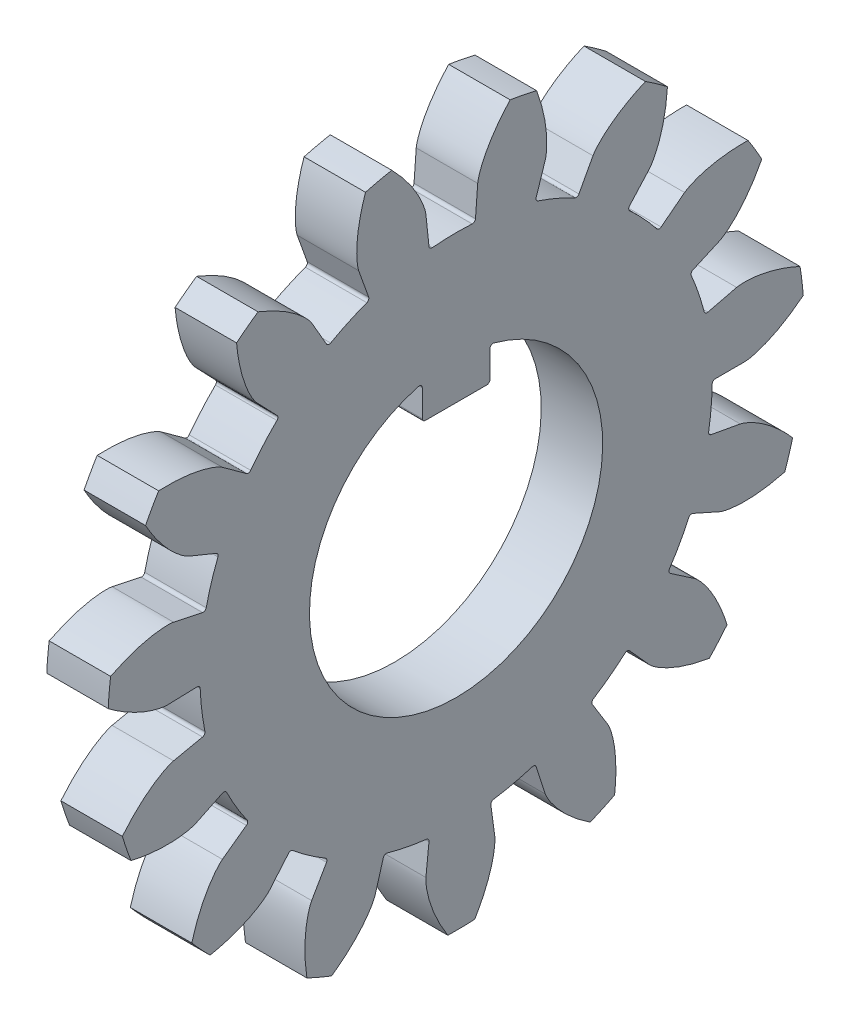
from build123d import *

# Parameters (mm, degrees)
SKETCH1_R                 = 11.333333333
BOSS_EXTRUDE1_DEPTH       = 1
CUT_EXTRUDE1_START        = -1
CUT_EXTRUDE1_DEPTH        = 2
FILLET1_R                 = 0.1
CIRPATTERN12_COUNT        = 15
FILLET1_OF_CIRPATTERN12_R = 0.1
CUT_EXTRUDE2_DEPTH        = 17.141635494
FILLET2_R                 = 0.1


# Read off the part's stored shape, not the designer's step: Cut-Extrude1
with BuildPart() as part:
    # Sketch1 → Boss-Extrude1 (new, symmetric)
    with BuildSketch(Plane(origin=(0, 0, 0), x_dir=(0, 0, -1), z_dir=(1, 0, 0))):
        Circle(SKETCH1_R)
    extrude(amount=BOSS_EXTRUDE1_DEPTH, both=True)

    # Cut-Extrude1 outline → Cut-Extrude1 (cut)
    with BuildSketch(Plane(origin=(0, 0, 0), x_dir=(0, 0, -1), z_dir=(1, 0, 0)).offset(CUT_EXTRUDE1_START)):
        with BuildLine():
            ThreePointArc((10.950535983, -2.920651662), (11.287652182, -1.01653955), (11.29616088, 0.917166185))
            add(Edge.make_bspline(
                [(11.29616088, 0.917166185), (11.279640182, 0.90399033), (11.237319146, 0.870555945), (11.155435851, 0.80693021), (11.07042047, 0.744723989), (10.955773539, 0.66282783), (10.852030268, 0.593612015), (10.738911244, 0.520825098), (10.628720419, 0.454581557), (10.513953634, 0.388998713), (10.399183597, 0.327986428), (10.281576815, 0.269499377), (10.16508062, 0.216257712), (10.06152026, 0.172827787), (9.972266099, 0.138572183), (9.897435615, 0.111957553), (9.835388227, 0.091379097), (9.772845578, 0.072160933), (9.709884453, 0.054493183), (9.646517918, 0.038506069), (9.588036436, 0.025602449), (9.534633285, 0.015508917), (9.489159988, 0.008411766), (9.453894805, 0.003965251), (9.426163522, 0.001399731), (9.409146235, 0.000318961), (9.400138583, 4.6216e-05), (9.396926208, 0)],
                knots=[0.016769687, 0.016769687, 0.016769687, 0.016769687, 0.016769687, 0.054732507, 0.109464833, 0.164197227, 0.218929528, 0.273661933, 0.328394299, 0.383126633, 0.437858978, 0.492591254, 0.547323563, 0.602055883, 0.65278357, 0.680149902, 0.707515959, 0.734882061, 0.762248419, 0.789614739, 0.816980389, 0.844236066, 0.862480775, 0.880559095, 0.894007227, 0.903714166, 0.909090915, 0.909090915, 0.909090915, 0.909090915, 0.909090915], degree=4))
            Line((9.396926208, 0), (8.333333333, 0))
            ThreePointArc((8.333333333, 0), (8.299744252, -0.747455552), (8.199247781, -1.48888558))
            Line((8.199247781, -1.48888558), (9.245727163, -1.678913751))
            add(Edge.make_bspline(
                [(9.245727163, -1.678913751), (9.248879593, -1.679533166), (9.257693579, -1.681410886), (9.274243956, -1.685514682), (9.301070663, -1.692993566), (9.334973978, -1.703669235), (9.378447576, -1.718776735), (9.429188083, -1.738249201), (9.48442314, -1.761393867), (9.543913733, -1.788445207), (9.602705165, -1.817077706), (9.660807849, -1.847160908), (9.718180202, -1.878494026), (9.787051507, -1.918050103), (9.868749224, -1.967701233), (9.962883807, -2.028935102), (10.067993057, -2.102134035), (10.173257852, -2.180692379), (10.275280372, -2.261228494), (10.376483086, -2.346261047), (10.473065426, -2.431126094), (10.571359767, -2.522952405), (10.66106725, -2.609589942), (10.7592374, -2.71065191), (10.831770707, -2.787046597), (10.900968706, -2.86427836), (10.936635188, -2.904736118), (10.950535983, -2.920651662)],
                knots=[0, 0, 0, 0, 0, 0.005376749, 0.015083688, 0.02853182, 0.04661014, 0.064854849, 0.092110525, 0.119476176, 0.146842496, 0.174208854, 0.201574956, 0.228941013, 0.256307345, 0.307035032, 0.361767352, 0.416499661, 0.471231937, 0.525964282, 0.580696616, 0.635428982, 0.690161387, 0.744893688, 0.799626082, 0.854358408, 0.892321228, 0.892321228, 0.892321228, 0.892321228, 0.892321228], degree=4))
        make_face()
    cut_extrude1 = extrude(amount=CUT_EXTRUDE1_DEPTH, mode=Mode.SUBTRACT)

    # Fillet1
    fillet1_edges = [part.edges().sort_by_distance(p)[0] for p in [
        (0, 0, -8.333333333),
        (0, -1.48888558, -8.199247781),
    ]]
    fillet(fillet1_edges, radius=FILLET1_R)

    # CirPattern12: Cut-Extrude1 ×15 about axis
    cirpattern12_axis = Axis((1, 0, 0), (-1, 0, 0))
    for i in range(1, CIRPATTERN12_COUNT):
        add(cut_extrude1.rotate(cirpattern12_axis, i * 360 / CIRPATTERN12_COUNT), mode=Mode.SUBTRACT)

    # Fillet1 of CirPattern12
    fillet1_of_cirpattern12_edges = [part.edges().sort_by_distance(p)[0] for p in [
        (0, -3.389472025, -7.612878813),
        (0, -4.695099177, -6.884801244),
        (0, -6.192873545, -5.576088386),
        (0, -7.089487472, -4.379910025),
        (0, -7.925470969, -2.57514162),
        (0, -8.258038978, -1.117692573),
        (0, -8.287682461, 0.871070527),
        (0, -7.998700522, 2.33778408),
        (0, -7.216878365, 4.166666666),
        (0, -6.35631408, 5.389036626),
        (0, -4.898210436, 6.741808286),
        (0, -3.614863189, 7.508475782),
        (0, -1.732597423, 8.151230006),
        (0, -0.248369612, 8.329631263),
        (0, 1.732597423, 8.151230006),
        (0, 3.161069327, 7.710517826),
        (0, 4.898210436, 6.741808286),
        (0, 6.023930662, 5.75818581),
        (0, 7.216878365, 4.166666667),
        (0, 7.84519966, 2.810211155),
        (0, 8.287682461, 0.871070527),
        (0, 8.309962365, -0.623674539),
        (0, 7.925470969, -2.57514162),
        (0, 7.337857084, -3.949721238),
        (0, 6.192873545, -5.576088386),
        (0, 5.09696965, -6.592825254),
        (0, 3.389472025, -7.612878813),
        (0, 1.97476986, -8.095969889),
    ]]
    fillet(fillet1_of_cirpattern12_edges, radius=FILLET1_OF_CIRPATTERN12_R)

    # Sketch3 → Cut-Extrude2 (cut, through all)
    with BuildSketch(Plane(origin=(1, 0, 0), x_dir=(0, 0, -1), z_dir=(1, 0, 0))):
        with BuildLine():
            Line((-1.1, 4.641432968), (-1.1, 3.541432968))
            Line((-1.1, 3.541432968), (1.1, 3.541432968))
            Line((1.1, 3.541432968), (1.1, 4.641432968))
            ThreePointArc((1.1, 4.641432968), (0, -4.77), (-1.1, 4.641432968))
        make_face()
    extrude(amount=-CUT_EXTRUDE2_DEPTH, mode=Mode.SUBTRACT)

    # Fillet2
    fillet2_edges = [part.edges().sort_by_distance(p)[0] for p in [
        (0, 4.641432968, -1.1),
        (0, 4.641432968, 1.1),
        (0, 3.541432968, 1.1),
        (0, 3.541432968, -1.1),
    ]]
    fillet(fillet2_edges, radius=FILLET2_R)


solid = part.part
